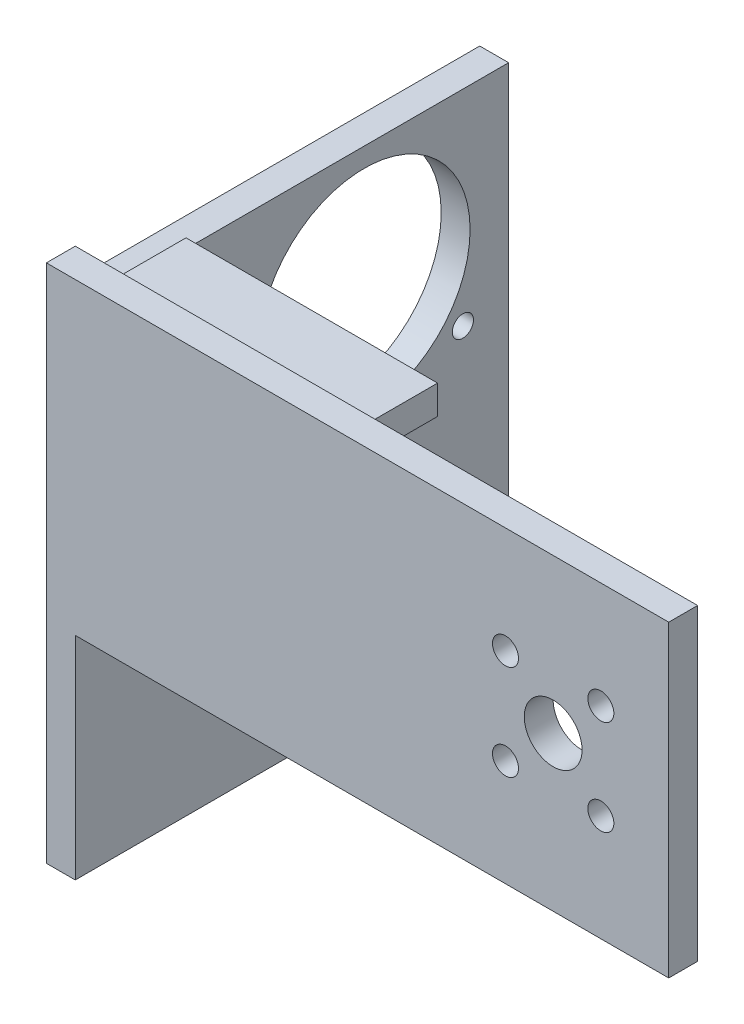
from build123d import *

# Parameters (mm, degrees)
S_BOX1_W      = 64.625
S_BOX1_H      = 32
BOSS_1_DEPTH  = 3
S_BOX2_W      = 3
S_BOX2_H      = 51
BOSS_2_DEPTH  = 45
S_BOX3_W      = 26.125
S_BOX3_H      = 3
BOSS_3_DEPTH  = 11.5
S_BOX4_W      = 26.125
S_BOX4_H      = 3
BOSS_4_DEPTH  = 11.5
S_HOLE5_R     = 3
HOLE_5_DEPTH  = 3.2
S_HOLE6_R     = 1.35
HOLE_6_DEPTH  = 3.2
S_HOLE7_R     = 1.35
HOLE_7_DEPTH  = 3.2
S_HOLE8_R     = 1.35
HOLE_8_DEPTH  = 3.2
S_HOLE9_R     = 1.35
HOLE_9_DEPTH  = 3.2
S_HOLE10_R    = 11
HOLE_10_DEPTH = 3.2
S_HOLE11_R    = 1.1
HOLE_11_DEPTH = 3.2
S_HOLE12_R    = 1.1
HOLE_12_DEPTH = 3.2
S_HOLE13_R    = 1.1
HOLE_13_DEPTH = 3.2
S_HOLE14_R    = 1.1
HOLE_14_DEPTH = 3.2


with BuildPart() as part:
    # S_box1 → Boss_1 (new body)
    with BuildSketch(Plane.XY.offset(27)):
        with Locations((-20.3125, 0)):
            Rectangle(S_BOX1_W, S_BOX1_H)
    extrude(amount=BOSS_1_DEPTH)

    # S_box2 → Boss_2 (add)
    with BuildSketch(Plane.XY.offset(-15)):
        with Locations((-51.125, -12.5)):
            Rectangle(S_BOX2_W, S_BOX2_H)
    extrude(amount=BOSS_2_DEPTH)

    # S_box3 → Boss_3 (add)
    with BuildSketch(Plane.XY.offset(18)):
        with Locations((-37.0625, 12)):
            Rectangle(S_BOX3_W, S_BOX3_H)
    extrude(amount=BOSS_3_DEPTH)

    # S_box4 → Boss_4 (add)
    with BuildSketch(Plane.XY.offset(18)):
        with Locations((-37.0625, -14.5)):
            Rectangle(S_BOX4_W, S_BOX4_H)
    extrude(amount=BOSS_4_DEPTH)

    # S_hole5 → Hole_5 (cut)
    with BuildSketch(Plane.XY.offset(26.9)):
        Circle(S_HOLE5_R)
    extrude(amount=HOLE_5_DEPTH, mode=Mode.SUBTRACT)

    # S_hole6 → Hole_6 (cut)
    with BuildSketch(Plane.XY.offset(26.9)):
        with Locations((4.949747468, 4.949747468)):
            Circle(S_HOLE6_R)
    extrude(amount=HOLE_6_DEPTH, mode=Mode.SUBTRACT)

    # S_hole7 → Hole_7 (cut)
    with BuildSketch(Plane.XY.offset(26.9)):
        with Locations((-4.949747468, 4.949747468)):
            Circle(S_HOLE7_R)
    extrude(amount=HOLE_7_DEPTH, mode=Mode.SUBTRACT)

    # S_hole8 → Hole_8 (cut)
    with BuildSketch(Plane.XY.offset(26.9)):
        with Locations((-4.949747468, -4.949747468)):
            Circle(S_HOLE8_R)
    extrude(amount=HOLE_8_DEPTH, mode=Mode.SUBTRACT)

    # S_hole9 → Hole_9 (cut)
    with BuildSketch(Plane.XY.offset(26.9)):
        with Locations((4.949747468, -4.949747468)):
            Circle(S_HOLE9_R)
    extrude(amount=HOLE_9_DEPTH, mode=Mode.SUBTRACT)

    # S_hole10 → Hole_10 (cut)
    with BuildSketch(Plane(origin=(-52.725, 0, 0), x_dir=(0, 0, -1), z_dir=(1, 0, 0))):
        Circle(S_HOLE10_R)
    extrude(amount=HOLE_10_DEPTH, mode=Mode.SUBTRACT)

    # S_hole11 → Hole_11 (cut)
    with BuildSketch(Plane(origin=(-52.725, 0, 0), x_dir=(0, 0, -1), z_dir=(1, 0, 0))):
        with Locations((10.25, -8.3)):
            Circle(S_HOLE11_R)
    extrude(amount=HOLE_11_DEPTH, mode=Mode.SUBTRACT)

    # S_hole12 → Hole_12 (cut)
    with BuildSketch(Plane(origin=(-52.725, 0, 0), x_dir=(0, 0, -1), z_dir=(1, 0, 0))):
        with Locations((-10.25, -8.3)):
            Circle(S_HOLE12_R)
    extrude(amount=HOLE_12_DEPTH, mode=Mode.SUBTRACT)

    # S_hole13 → Hole_13 (cut)
    with BuildSketch(Plane(origin=(-52.725, 0, 0), x_dir=(0, 0, -1), z_dir=(1, 0, 0))):
        with Locations((10.25, -32.75)):
            Circle(S_HOLE13_R)
    extrude(amount=HOLE_13_DEPTH, mode=Mode.SUBTRACT)

    # S_hole14 → Hole_14 (cut)
    with BuildSketch(Plane(origin=(-52.725, 0, 0), x_dir=(0, 0, -1), z_dir=(1, 0, 0))):
        with Locations((-10.25, -32.75)):
            Circle(S_HOLE14_R)
    extrude(amount=HOLE_14_DEPTH, mode=Mode.SUBTRACT)


solid = part.part
